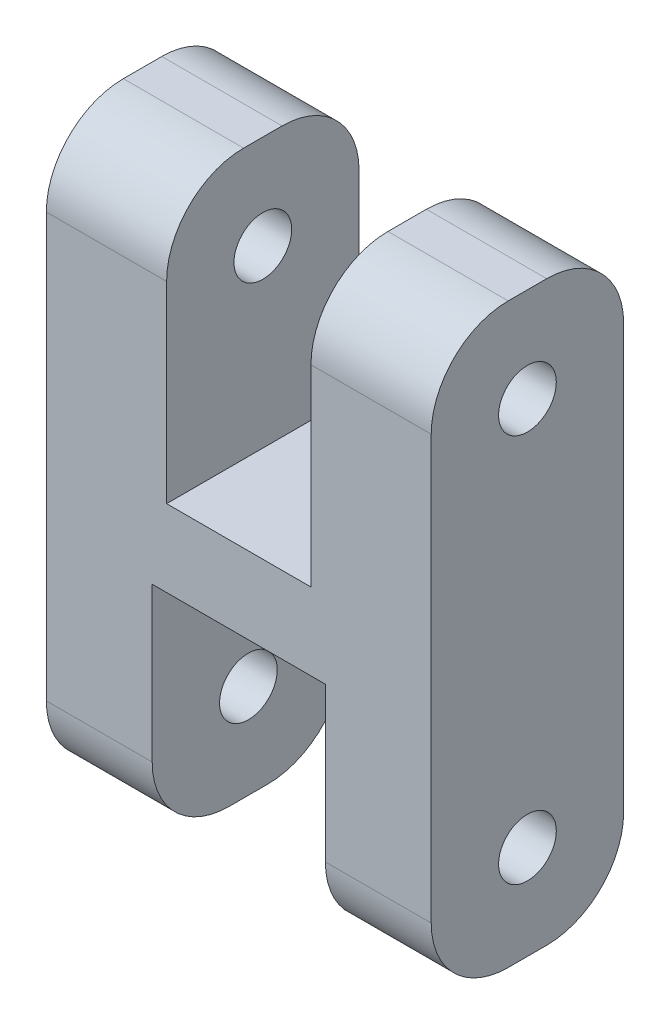
from build123d import *

# Parameters (mm, degrees)
CROQUIS1_R                 = 1.5
SALIENTE_EXTRUIR1_DEPTH    = 10
CORTAR_EXTRUIR1_DEPTH      = 19.708286934
CORTAR_EXTRUIR1_DEPTH_BACK = 19.708286934
CROQUIS2_W                 = 9
CROQUIS2_H                 = 12
CROQUIS2_W_2               = 7.5
CROQUIS2_H_2               = 14


with BuildPart() as part:
    # Croquis1 → Saliente-Extruir1 (new, symmetric)
    with BuildSketch(Plane(origin=(0, 0, 0), x_dir=(0, 0, -1), z_dir=(1, 0, 0))):
        with BuildLine():
            Line((-1, 15), (1, 15))
            ThreePointArc((1, 15), (3.828427125, 13.828427125), (5, 11))
            Line((5, 11), (5, -11))
            ThreePointArc((5, -11), (3.828427125, -13.828427125), (1, -15))
            Line((1, -15), (-1, -15))
            ThreePointArc((-1, -15), (-3.828427125, -13.828427125), (-5, -11))
            Line((-5, -11), (-5, 11))
            ThreePointArc((-5, 11), (-3.828427125, 13.828427125), (-1, 15))
        make_face()
        with Locations((0, 10.1)):
            Circle(CROQUIS1_R, mode=Mode.SUBTRACT)
        with Locations((0, -10.1)):
            Circle(CROQUIS1_R, mode=Mode.SUBTRACT)
    extrude(amount=SALIENTE_EXTRUIR1_DEPTH, both=True)

    # Croquis2 → Cortar-Extruir1 (cut, two sides: drawn at the far end of the back side and taken through both)
    with BuildSketch(Plane.XY.offset(-CORTAR_EXTRUIR1_DEPTH_BACK)):
        with Locations((0, -9)):
            Rectangle(CROQUIS2_W, CROQUIS2_H)
        with Locations((0, 8)):
            Rectangle(CROQUIS2_W_2, CROQUIS2_H_2)
    extrude(amount=CORTAR_EXTRUIR1_DEPTH + CORTAR_EXTRUIR1_DEPTH_BACK, mode=Mode.SUBTRACT)


solid = part.part
